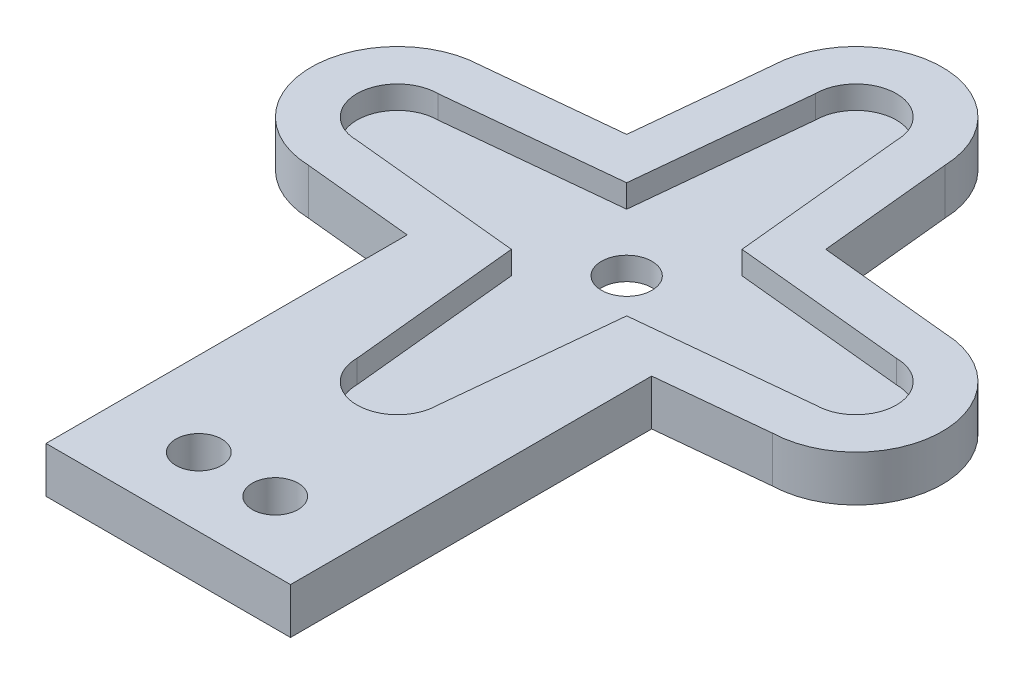
from build123d import *
from build123d.topology import SkipClean

# Parameters (mm, degrees)
SKETCH1_R               = 21
BOSS_EXTRUDE1_DEPTH     = 1.5
SKETCH2_R               = 2.65
CUT_EXTRUDE1_DEPTH      = 1.5
SKETCH5_W               = 16
SKETCH5_H               = 30
BOSS_EXTRUDE2_DEPTH     = 1.5
CIRPATTERN1_DEPTH       = 1.5
CUT_EXTRUDE4_REACH      = 38.65
SKETCH4_R               = 1.65
CUT_EXTRUDE5_REACH      = 38.742
SKETCH6_R               = 1.5
CUT_EXTRUDE6_DEPTH      = 37.650375169
CUT_EXTRUDE6_DEPTH_BACK = 37.650375169


# Read off the part's stored shape, not the designer's step: CirPattern1
with BuildPart() as part:
    # Sketch1 → Boss-Extrude1 (new, symmetric)
    with BuildSketch(Plane(origin=(0, 0, 0), x_dir=(1, 0, 0), z_dir=(0, 1, 0))):
        with Locations(Location((0, 0, 0), (0, 0, 270))):
            Circle(SKETCH1_R)
    extrude(amount=BOSS_EXTRUDE1_DEPTH, both=True)

    # Sketch2 → Cut-Extrude1 (cut)
    with BuildSketch(Plane(origin=(0, 1.5, 0), x_dir=(1, 0, 0), z_dir=(0, 1, 0))):
        with Locations((0, -15)):
            Circle(SKETCH2_R)
        with BuildLine():
            ThreePointArc((-2.65, -15), (0, -12.35), (2.65, -15))
            Line((2.65, -15), (4.067821782, -0.821782178))
            ThreePointArc((4.067821782, -0.821782178), (0, -4.15), (-4.067821782, -0.821782178))
            Line((-4.067821782, -0.821782178), (-2.65, -15))
        make_face()
        with BuildLine():
            ThreePointArc((-4.067821782, -0.821782178), (0, -4.15), (4.067821782, -0.821782178))
            Line((4.067821782, -0.821782178), (4.15, 0))
            ThreePointArc((4.15, 0), (0, 4.15), (-4.15, 0))
            Line((-4.15, 0), (-4.067821782, -0.821782178))
        make_face()
    cut_extrude1 = extrude(amount=-CUT_EXTRUDE1_DEPTH, mode=Mode.SUBTRACT)

    # Sketch5 → Boss-Extrude2 (add, symmetric)
    with BuildSketch(Plane(origin=(0, 0, 0), x_dir=(1, 0, 0), z_dir=(0, 1, 0))):
        with Locations((0, -15)):
            Rectangle(SKETCH5_W, SKETCH5_H)
    extrude(amount=BOSS_EXTRUDE2_DEPTH, both=True)

    # Mirror1: Cut-Extrude1 across plane
    with SkipClean():  # the faces are left unmerged after this step: merging them gives an invalid solid
        add(cut_extrude1.mirror(Plane.XY), mode=Mode.SUBTRACT)

    # CirPattern1 outline → CirPattern1 (cut)
    with BuildSketch(Plane(origin=(0, 0, 0), x_dir=(1, 0, 0), z_dir=(0, 1, 0))):
        with BuildLine():
            Line((3.772727273, -3.772727273), (15, -2.65))
            ThreePointArc((15, -2.65), (17.65, 0), (15, 2.65))
            Line((15, 2.65), (3.772727273, 3.772727273))
            Line((3.772727273, 3.772727273), (4.067821782, 0.821782178))
            ThreePointArc((4.067821782, 0.821782178), (0, -4.15), (-4.067821782, 0.821782178))
            Line((-4.067821782, 0.821782178), (-3.772727273, 3.772727273))
            Line((-3.772727273, 3.772727273), (-15, 2.65))
            ThreePointArc((-15, 2.65), (-17.65, 0), (-15, -2.65))
            Line((-15, -2.65), (-3.772727273, -3.772727273))
            Line((-3.772727273, -3.772727273), (-2.65, -15))
            ThreePointArc((-2.65, -15), (0, -17.65), (2.65, -15))
            Line((2.65, -15), (3.772727273, -3.772727273))
        make_face()
    extrude(amount=CIRPATTERN1_DEPTH, mode=Mode.SUBTRACT)

    # Sketch4 → Cut-Extrude4 (cut, up to next)
    with BuildSketch(Plane(origin=(0, 0, 0), x_dir=(1, 0, 0), z_dir=(0, 1, 0)), mode=Mode.PRIVATE) as cut_extrude4_sk1:
        with Locations(Location((0, 0, 0), (0, 0, 270))):
            Circle(SKETCH4_R)
    cut_extrude4_tool1 = extrude(cut_extrude4_sk1.sketch, amount=-CUT_EXTRUDE4_REACH, mode=Mode.PRIVATE) & part.part
    add(cut_extrude4_tool1.solids().sort_by_distance((0, 0, 0))[0], mode=Mode.SUBTRACT)

    # Sketch6 → Cut-Extrude5 (cut, up to next)
    with BuildSketch(Plane(origin=(0, 1.5, 0), x_dir=(1, 0, 0), z_dir=(0, 1, 0)), mode=Mode.PRIVATE) as cut_extrude5_sk1:
        with Locations(Location((2.5, -25.5, 0), (0, 0, 270))):
            Circle(SKETCH6_R)
    cut_extrude5_tool1 = extrude(cut_extrude5_sk1.sketch, amount=-CUT_EXTRUDE5_REACH, mode=Mode.PRIVATE) & part.part
    # Sketch6 → Cut-Extrude5 (cut, up to next)
    with BuildSketch(Plane(origin=(0, 1.5, 0), x_dir=(1, 0, 0), z_dir=(0, 1, 0)), mode=Mode.PRIVATE) as cut_extrude5_sk2:
        with Locations(Location((-2.5, -25.5, 0), (0, 0, 270))):
            Circle(SKETCH6_R)
    cut_extrude5_tool2 = extrude(cut_extrude5_sk2.sketch, amount=-CUT_EXTRUDE5_REACH, mode=Mode.PRIVATE) & part.part
    add(cut_extrude5_tool1.solids().sort_by_distance((2.5, 1.5, 25.5))[0], mode=Mode.SUBTRACT)
    add(cut_extrude5_tool2.solids().sort_by_distance((-2.5, 1.5, 25.5))[0], mode=Mode.SUBTRACT)

    # Sketch7 → Cut-Extrude6 (cut, two sides: drawn at the far end of the back side and taken through both)
    with BuildSketch(Plane(origin=(0, 0, 0), x_dir=(1, 0, 0), z_dir=(0, 1, 0)).offset(-CUT_EXTRUDE6_DEPTH_BACK)):
        with BuildLine():
            ThreePointArc((8, -19.416487839), (0, 21), (-8, -19.416487839))
            Line((-8, -19.416487839), (-8, -6.364962686))
            Line((-8, -6.364962686), (-15.177522436, -5.647210443))
            ThreePointArc((-15.177522436, -5.647210443), (-20.65, 0), (-15.177522436, 5.647210443))
            Line((-15.177522436, 5.647210443), (-6.513602442, 6.513602442))
            Line((-6.513602442, 6.513602442), (-5.647210443, 15.177522436))
            ThreePointArc((-5.647210443, 15.177522436), (0, 20.65), (5.647210443, 15.177522436))
            Line((5.647210443, 15.177522436), (6.513602442, 6.513602442))
            Line((6.513602442, 6.513602442), (15.177522436, 5.647210443))
            ThreePointArc((15.177522436, 5.647210443), (20.65, 0), (15.177522436, -5.647210443))
            Line((15.177522436, -5.647210443), (8, -6.364962686))
            Line((8, -6.364962686), (8, -19.416487839))
        make_face()
    extrude(amount=CUT_EXTRUDE6_DEPTH + CUT_EXTRUDE6_DEPTH_BACK, mode=Mode.SUBTRACT)


solid = part.part
